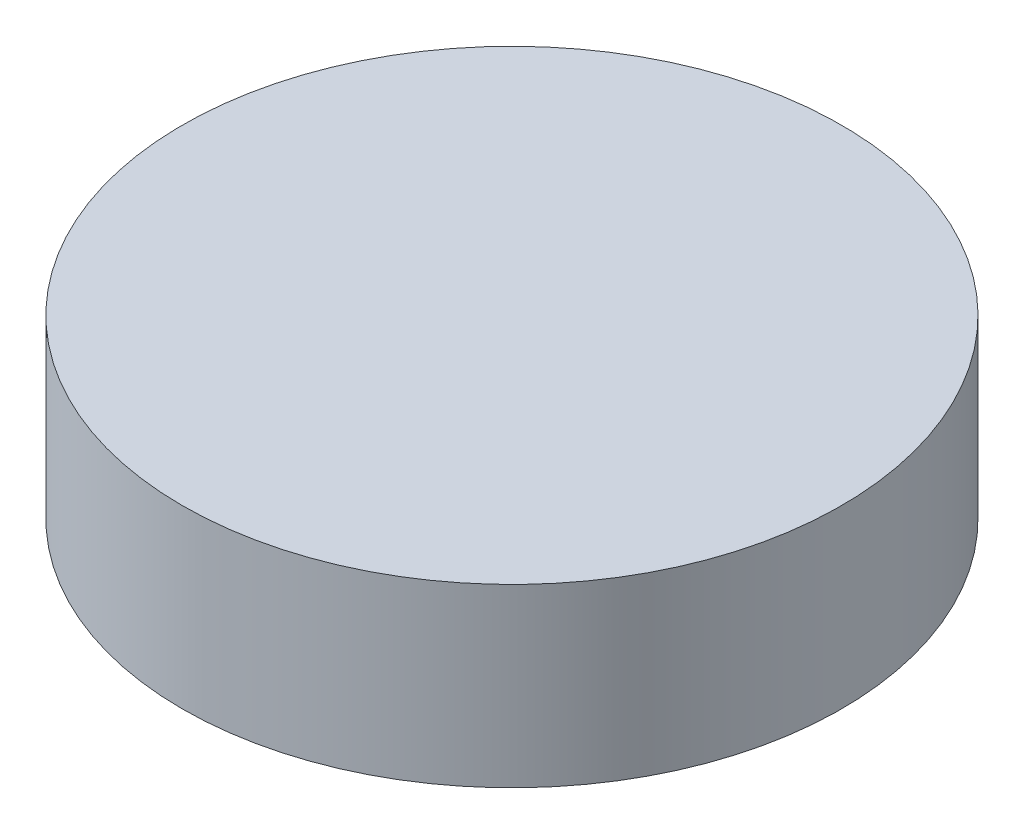
from build123d import *

# Parameters (mm, degrees)
SKETCH1_R           = 28.194
BOSS_EXTRUDE1_DEPTH = 12.7
SHELL2_T            = 5.08
THREAD1_PITCH       = 6.35


with BuildPart() as part:
    # Sketch1 → Boss-Extrude1 (new body)
    with BuildSketch(Plane(origin=(0, 0, 0), x_dir=(1, 0, 0), z_dir=(0, 1, 0))):
        with Locations(Location((0, 0, 0), (0, 0, 270))):
            Circle(SKETCH1_R)
    extrude(amount=BOSS_EXTRUDE1_DEPTH)

    # Shell2
    shell2_openings = [part.faces().sort_by_distance(p)[0] for p in [
        (0, 0, 0),
    ]]
    offset(amount=SHELL2_T, openings=shell2_openings, kind=Kind.INTERSECTION)

    # Thread1: the profile of Thread Profile1 profile screwed along a right-hand helix of 2.2 turns, 14 arcs to a turn; built about Z, then put on its axis
    thread1_z = Axis((0, 0, 0), (0, 0, 1))
    thread1_corners = [(28.1937, 0, -0.000173205), (31.631038306, 0, 1.984374991), (31.631038306, 0, 2.778124991), (28.1937, 0, 4.762673188)]
    with BuildLine(mode=Mode.PRIVATE) as thread1_profile:
        Line(thread1_corners[0], thread1_corners[1])
        Line(thread1_corners[1], thread1_corners[2])
        Line(thread1_corners[2], thread1_corners[3])
        Line(thread1_corners[3], thread1_corners[0])
    thread1_cap = Face(thread1_profile.wire())
    thread1_turn_angles = [0, 12.857142857, 25.714285714, 38.571428571, 51.428571429, 64.285714286, 77.142857143, 90, 102.857142857, 115.714285714, 128.571428571, 141.428571429, 154.285714286, 167.142857143, 180, 192.857142857, 205.714285714, 218.571428571, 231.428571429, 244.285714286, 257.142857143, 270, 282.857142857, 295.714285714, 308.571428571, 321.428571429, 334.285714286, 347.142857143, 360]
    thread1_turn_weights = [1, 0.9749279121818236, 1, 0.9749279121818236, 1, 0.9749279121818236, 1, 0.9749279121818236, 1, 0.9749279121818236, 1, 0.9749279121818236, 1, 0.9749279121818236, 1, 0.9749279121818236, 1, 0.9749279121818236, 1, 0.9749279121818236, 1, 0.9749279121818236, 1, 0.9749279121818237, 1, 0.9749279121818236, 1, 0.9749279121818236, 1]
    thread1_turn_rails = [Edge.make_bspline([Vector(p[0], p[1], 0).rotate(thread1_z, thread1_turn_angles[k]) / thread1_turn_weights[k] + Vector(0, 0, p[2] + THREAD1_PITCH * thread1_turn_angles[k] / 360) for k in range(29)], [0, 0, 0, 1, 1, 2, 2, 3, 3, 4, 4, 5, 5, 6, 6, 7, 7, 8, 8, 9, 9, 10, 10, 11, 11, 12, 12, 13, 13, 14, 14, 14], 2, thread1_turn_weights) for p in thread1_corners]
    thread1_turn_sides = [Face.make_surface_from_curves(thread1_turn_rails[p[0]], thread1_turn_rails[p[1]]) for p in [(0, 1), (1, 2), (2, 3), (3, 0)]]
    thread1_last_angles = [720, 732.857142857, 745.714285714, 758.571428571, 771.428571429, 781.714285714, 792]
    thread1_last_weights = [1, 0.9749279121818237, 1, 0.9749279121818235, 1, 0.9839295885986297, 1]
    thread1_last_rails = [Edge.make_bspline([Vector(p[0], p[1], 0).rotate(thread1_z, thread1_last_angles[k]) / thread1_last_weights[k] + Vector(0, 0, p[2] + THREAD1_PITCH * thread1_last_angles[k] / 360) for k in range(7)], [0, 0, 0, 1, 1, 2, 2, 3, 3, 3], 2, thread1_last_weights) for p in thread1_corners]
    thread1_last_sides = [Face.make_surface_from_curves(thread1_last_rails[p[0]], thread1_last_rails[p[1]]) for p in [(0, 1), (1, 2), (2, 3), (3, 0)]]
    thread1 = Plane(origin=(0, 12.7, 0), x_dir=(-1, 0, 0), z_dir=(0, -1, 0)) * Solid(Shell([*[p.moved(Location((0, 0, THREAD1_PITCH * i))) for i in range(2) for p in thread1_turn_sides], *thread1_last_sides, thread1_cap, thread1_cap.rotate(thread1_z, 792).moved(Location((0, 0, THREAD1_PITCH * 792 / 360)))]))
    add(thread1, mode=Mode.SUBTRACT)

    # Sketch4 → Revolve1 (revolve)
    with BuildSketch(Plane(origin=(0, 0, 0), x_dir=(0, 0, -1), z_dir=(1, 0, 0)), mode=Mode.PRIVATE) as revolve1_sk:
        Polygon((19.939, 9.528092013), (19.939, 13.084092013), (24.13, 13.084092013), (24.13, 17.728219207), (0, 17.728219207), (0, 9.528092013), align=None)
    revolve(revolve1_sk.sketch.rotate(Axis((0, 17.728219207, 0), (0, -1, 0)), 180), axis=Axis((0, 17.728219207, 0), (0, -1, 0)))


solid = part.part
